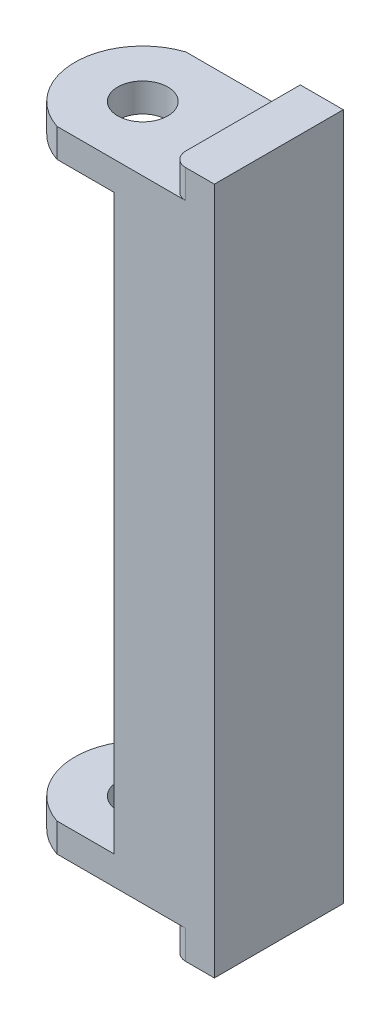
from build123d import *

# Parameters (mm, degrees)
SKETCH1_R           = 1.75
BOSS_EXTRUDE3_DEPTH = 2
BOSS_EXTRUDE4_DEPTH = 20
BOSS_EXTRUDE5_DEPTH = 4


with BuildPart() as part:
    # Sketch1 → Boss-Extrude3 (new body)
    with BuildSketch(Plane(origin=(0, 0, 0), x_dir=(1, 0, 0), z_dir=(0, 1, 0))):
        with BuildLine():
            ThreePointArc((-3.991008085, 4.5), (-7.240580672, 0), (-3.991008085, -4.5))
            Line((-3.991008085, -4.5), (7, -4.5))
            Line((7, -4.5), (7, 4.5))
            Line((7, 4.5), (-3.991008085, 4.5))
        make_face()
        with Locations((-2.5, 0)):
            Circle(SKETCH1_R, mode=Mode.SUBTRACT)
    extrude(amount=BOSS_EXTRUDE3_DEPTH)

    # Sketch1<3> → Boss-Extrude4 (add)
    with BuildSketch(Plane(origin=(0, 0, 0), x_dir=(1, 0, 0), z_dir=(0, 1, 0))):
        with BuildLine():
            ThreePointArc((0.004495957, 4.5), (2.65, 0), (0.004495957, -4.5))
            Line((0.004495957, -4.5), (7, -4.5))
            Line((7, -4.5), (7, 4.5))
            Line((7, 4.5), (0.004495957, 4.5))
        make_face()
    extrude(amount=-BOSS_EXTRUDE4_DEPTH)

    # Sketch1<5> → Boss-Extrude5 (add)
    with BuildSketch(Plane(origin=(0, 0, 0), x_dir=(1, 0, 0), z_dir=(0, 1, 0))):
        with BuildLine():
            Line((5.019474666, 4.5), (4, 4.5))
            Line((4, 4.5), (4, -3.5))
            ThreePointArc((4, -3.5), (4.292893219, -4.207106781), (5, -4.5))
            Line((5, -4.5), (7, -4.5))
            Line((7, -4.5), (7, 4.5))
            Line((7, 4.5), (5.019474666, 4.5))
        make_face()
    extrude(amount=BOSS_EXTRUDE5_DEPTH)

    # Mirror1: part across plane


with BuildPart() as part_1:
    add(part.part)
    add(part.part.mirror(Plane.ZX.offset(-20)))


solid = part_1.part
